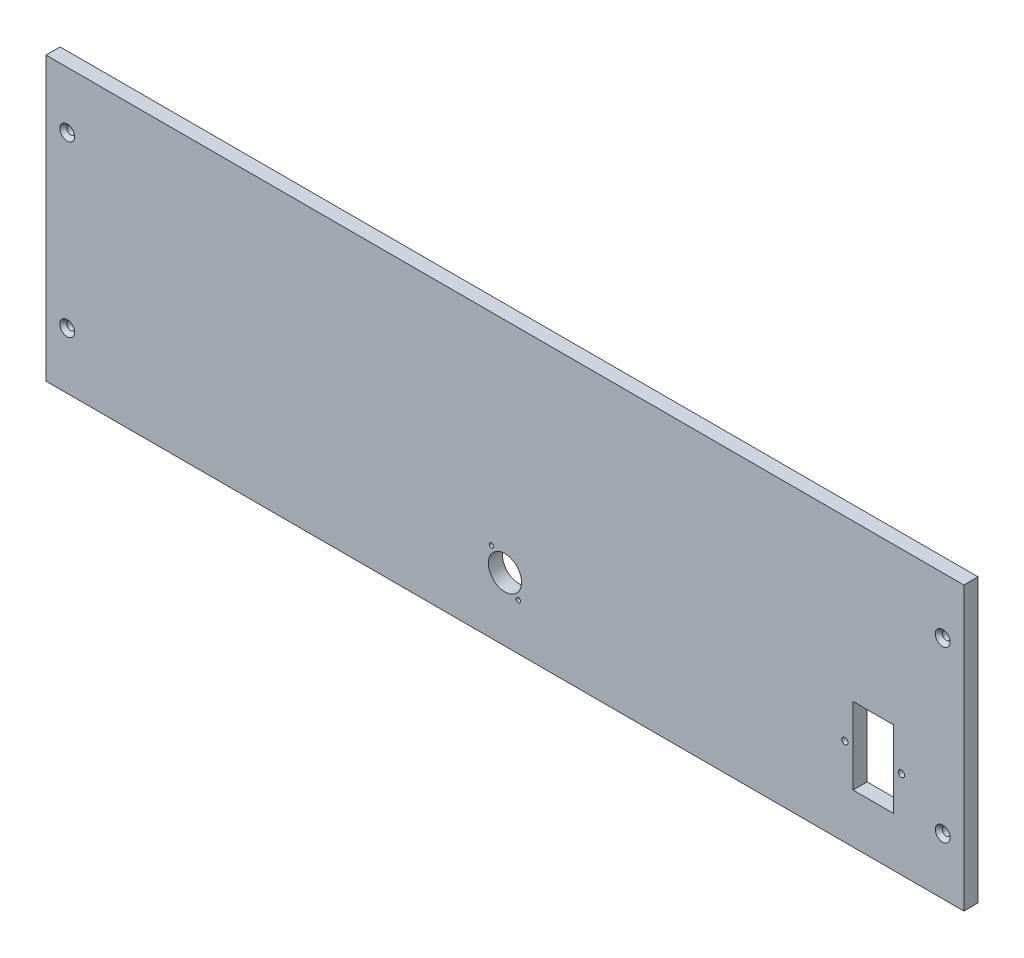
from build123d import *

# Parameters (mm, degrees)
ESQUISSE1_W             = 650
ESQUISSE1_H             = 200
BOSS_EXTRU_1_DEPTH      = 10
ESQUISSE2_R             = 2.75
ENL_V_MAT_EXTRU_1_DEPTH = 10
CHANFREIN1_SIZE         = 2.5
ESQUISSE3_R             = 1.6
ESQUISSE3_R_2           = 11.75
ESQUISSE3_W             = 28.5
ESQUISSE3_H             = 54.3
ESQUISSE3_R_3           = 2.25
ENL_V_MAT_EXTRU_2_DEPTH = 10


with BuildPart() as part:
    # Esquisse1 → Boss.-Extru.1 (new body)
    with BuildSketch(Plane.XY):
        with Locations((325, 100)):
            Rectangle(ESQUISSE1_W, ESQUISSE1_H)
    extrude(amount=BOSS_EXTRU_1_DEPTH)

    # Esquisse2 → Enlèv. mat.-Extru.1 (cut)
    with BuildSketch(Plane.XY.offset(10)):
        with Locations((15, 160)):
            Circle(ESQUISSE2_R)
        with Locations((635, 160)):
            Circle(ESQUISSE2_R)
        with Locations((15, 40)):
            Circle(ESQUISSE2_R)
        with Locations((635, 40)):
            Circle(ESQUISSE2_R)
    extrude(amount=-ENL_V_MAT_EXTRU_1_DEPTH, mode=Mode.SUBTRACT)

    # Chanfrein1
    chanfrein1_edges = [part.edges().sort_by_distance(p)[0] for p in [
        (12.25, 160, 10),
        (12.25, 40, 10),
        (632.25, 40, 10),
        (632.25, 160, 10),
    ]]
    chamfer(chanfrein1_edges, length=CHANFREIN1_SIZE)

    # Esquisse3 → Enlèv. mat.-Extru.2 (cut)
    with BuildSketch(Plane.XY.offset(10)):
        with Locations((315.499614794, 56.999404399)):
            Circle(ESQUISSE3_R)
        with Locations((325, 45)):
            Circle(ESQUISSE3_R_2)
        with Locations((334.500385206, 33.000595601)):
            Circle(ESQUISSE3_R)
        with Locations((585.75, 62.15)):
            Rectangle(ESQUISSE3_W, ESQUISSE3_H)
        with Locations((565.75, 62.15)):
            Circle(ESQUISSE3_R_3)
        with Locations((605.75, 62.15)):
            Circle(ESQUISSE3_R_3)
    extrude(amount=-ENL_V_MAT_EXTRU_2_DEPTH, mode=Mode.SUBTRACT)


solid = part.part
